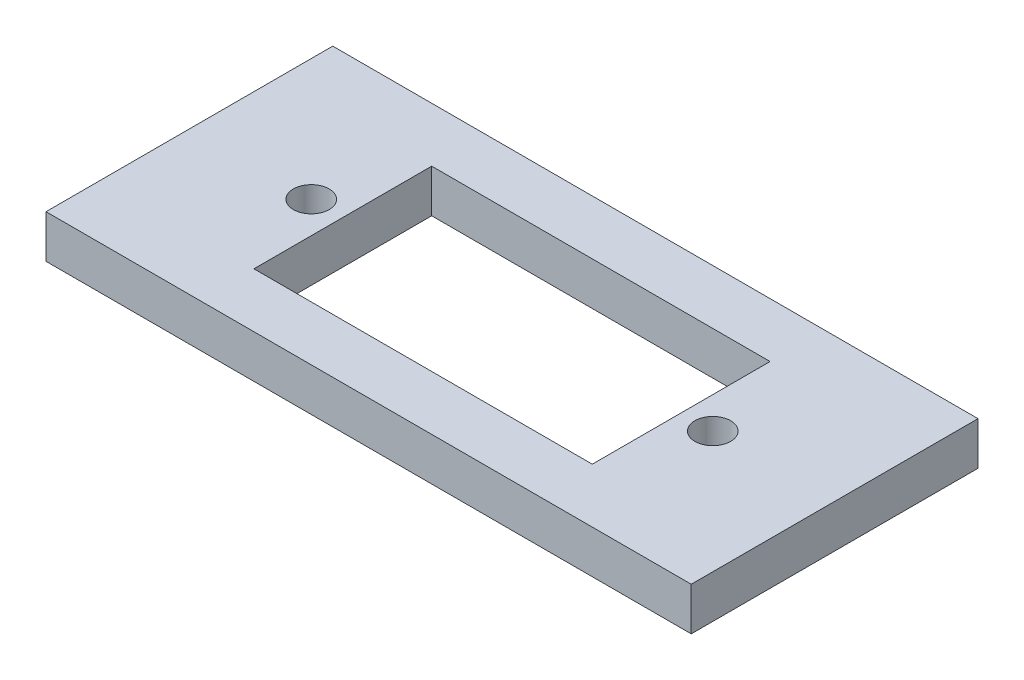
from build123d import *

# Parameters (mm, degrees)
CROQUIS1_W              = 45
CROQUIS1_H              = 20
CROQUIS1_R              = 1.25
CROQUIS1_W_2            = 23.6
CROQUIS1_H_2            = 12.4
SALIENTE_EXTRUIR1_DEPTH = 3


with BuildPart() as part:
    # Croquis1 → Saliente-Extruir1 (new body)
    with BuildSketch(Plane(origin=(0, 0, 0), x_dir=(1, 0, 0), z_dir=(0, 1, 0))):
        Rectangle(CROQUIS1_W, CROQUIS1_H)
        with Locations((14, 0)):
            Circle(CROQUIS1_R, mode=Mode.SUBTRACT)
        with Locations((-14, 0)):
            Circle(CROQUIS1_R, mode=Mode.SUBTRACT)
        Rectangle(CROQUIS1_W_2, CROQUIS1_H_2, mode=Mode.SUBTRACT)
    extrude(amount=SALIENTE_EXTRUIR1_DEPTH)


solid = part.part
